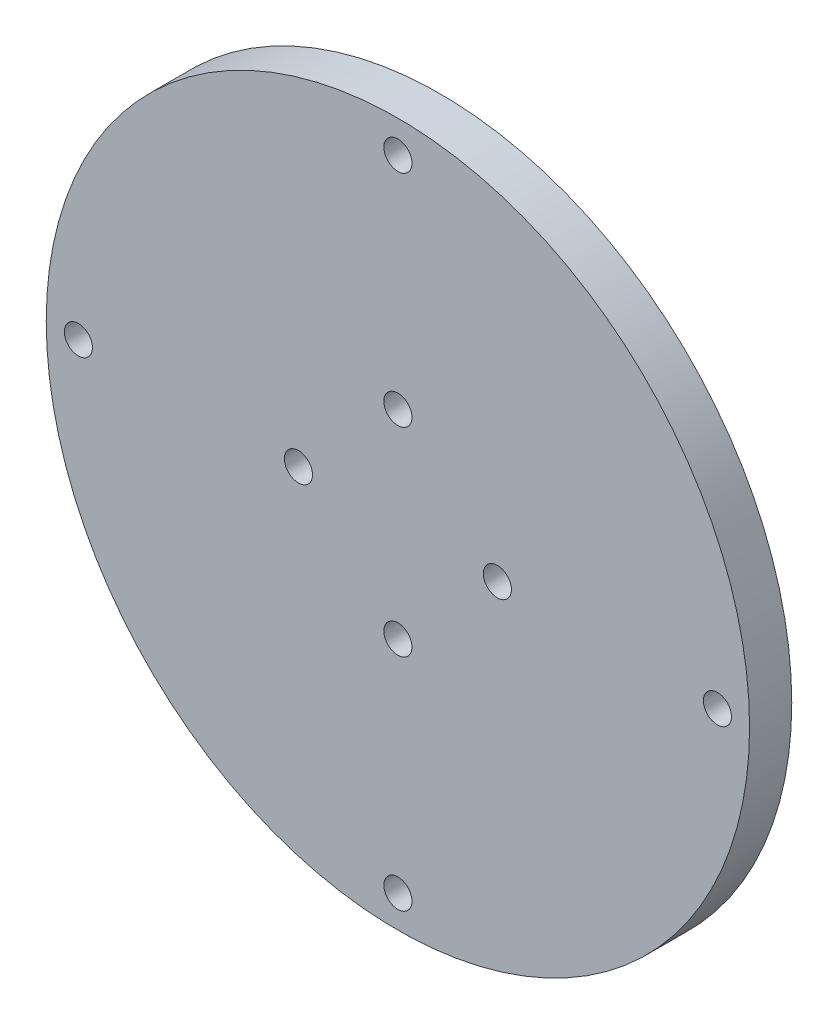
from build123d import *

# Parameters (mm, degrees)
SKETCH1_R           = 25
SKETCH1_R_2         = 1
BOSS_EXTRUDE1_DEPTH = 1.5


with BuildPart() as part:
    # Sketch1 → Boss-Extrude1 (new, symmetric)
    with BuildSketch(Plane.XY):
        Circle(SKETCH1_R)
        with Locations((0, 22.715)):
            Circle(SKETCH1_R_2, mode=Mode.SUBTRACT)
        with Locations((-22.715, 0)):
            Circle(SKETCH1_R_2, mode=Mode.SUBTRACT)
        with Locations((0, -22.715)):
            Circle(SKETCH1_R_2, mode=Mode.SUBTRACT)
        with Locations((22.715, 0)):
            Circle(SKETCH1_R_2, mode=Mode.SUBTRACT)
        with Locations((0, -7.071067812)):
            Circle(SKETCH1_R_2, mode=Mode.SUBTRACT)
        with Locations((-7.071067812, 0)):
            Circle(SKETCH1_R_2, mode=Mode.SUBTRACT)
        with Locations((7.071067812, 0)):
            Circle(SKETCH1_R_2, mode=Mode.SUBTRACT)
        with Locations((0, 7.071067812)):
            Circle(SKETCH1_R_2, mode=Mode.SUBTRACT)
    extrude(amount=BOSS_EXTRUDE1_DEPTH, both=True)


solid = part.part
